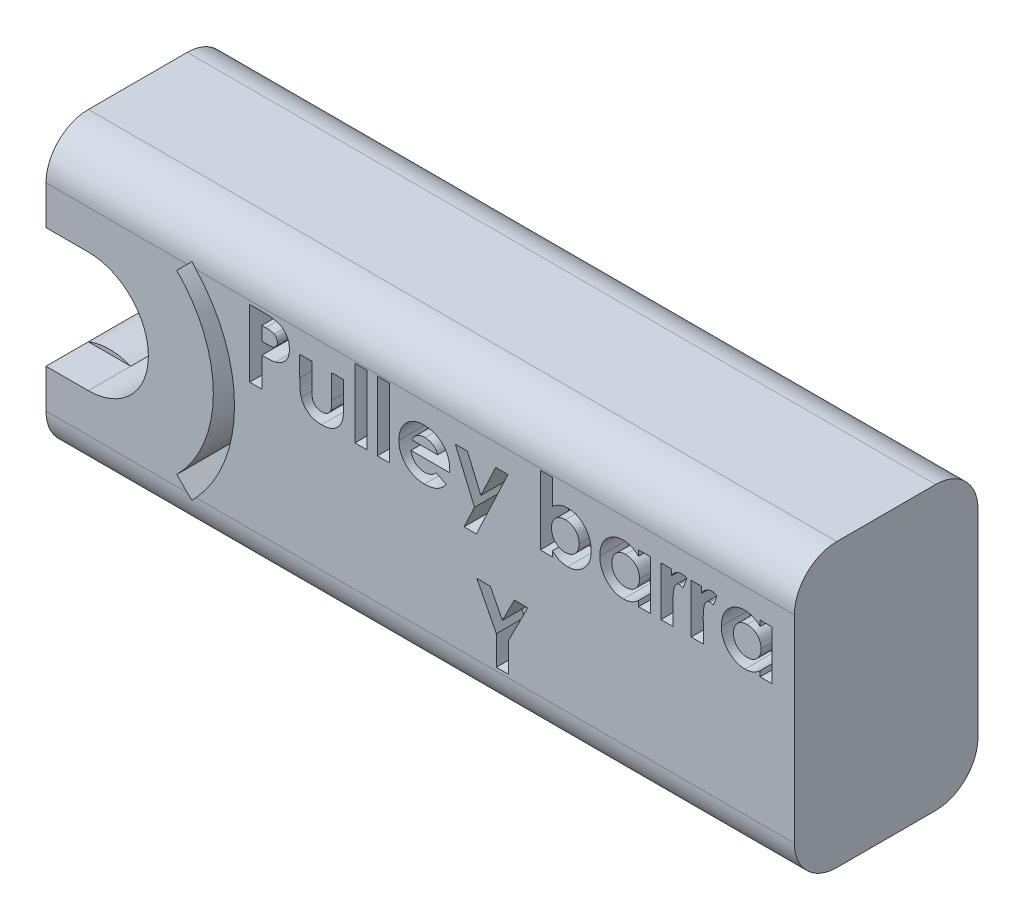
from build123d import *

# Parameters (mm, degrees)
SALIENTE_EXTRUIR1_DEPTH = 13
CORTAR_EXTRUIR1_DEPTH   = 5
CROQUIS4_W              = 0.854807692
CROQUIS4_H              = 4.884615385
CORTAR_EXTRUIR2_DEPTH   = 2
CROQUIS6_W              = 13
CROQUIS6_H              = 5.75
SALIENTE_EXTRUIR3_DEPTH = 3
REDONDEO1_R             = 3
SALIENTE_EXTRUIR4_START = -3
SALIENTE_EXTRUIR4_DEPTH = 7


with BuildPart() as part:
    # Croquis1 → Saliente-Extruir1 (new body)
    with BuildSketch(Plane.XY):
        with BuildLine():
            Line((0, 0), (0, 20))
            Line((0, 20), (-50, 20))
            Line((-50, 20), (-50, 14.25))
            ThreePointArc((-50, 14.25), (-45.75, 10), (-50, 5.75))
            Line((-50, 5.75), (-50, 0))
            Line((-50, 0), (0, 0))
        make_face()
    extrude(amount=SALIENTE_EXTRUIR1_DEPTH)

    # Croquis3 → Cortar-Extruir1 (cut)
    with BuildSketch(Plane.XY.offset(13)):
        with BuildLine():
            Line((-42.681444815, 17.318555185), (-43.742104986, 16.257895014))
            ThreePointArc((-43.742104986, 16.257895014), (-41.823666137, 13.386748376), (-41.15, 10))
            ThreePointArc((-41.15, 10), (-41.823666137, 6.613251624), (-43.742104986, 3.742104986))
            Line((-43.742104986, 3.742104986), (-42.681444815, 2.681444815))
            ThreePointArc((-42.681444815, 2.681444815), (-40.437846839, 6.039226475), (-39.65, 10))
            ThreePointArc((-39.65, 10), (-40.437846839, 13.960773525), (-42.681444815, 17.318555185))
        make_face()
    extrude(amount=-CORTAR_EXTRUIR1_DEPTH, mode=Mode.SUBTRACT)

    # Croquis4 → Cortar-Extruir2 (cut)
    # profile 1 of 12: a face of its own
    with BuildSketch(Plane.XY.offset(13)):
        with BuildLine():
            Line((-38.572356938, 16.74930767), (-37.618330495, 16.74930767))
            add(Edge.make_bspline(
                [(-37.618330495, 16.74930767), (-37.555995645, 16.749028646), (-37.435738653, 16.74849035), (-37.262318177, 16.741962797), (-37.102329296, 16.730265023), (-36.955808768, 16.715808424), (-36.822816839, 16.695540835), (-36.703186963, 16.672305632), (-36.596894313, 16.643998391), (-36.502740283, 16.610398089), (-36.418240082, 16.570784646), (-36.338275638, 16.528593501), (-36.264654156, 16.478239858), (-36.193659738, 16.425150618), (-36.129351257, 16.364254186), (-36.067716765, 16.29960331), (-36.011366651, 16.228633987), (-35.960039809, 16.152205282), (-35.913478455, 16.071729272), (-35.87279934, 15.987062089), (-35.839802721, 15.898069755), (-35.812122661, 15.805327951), (-35.789889766, 15.708840718), (-35.775090844, 15.60801465), (-35.765038671, 15.503553755), (-35.764151706, 15.432457604), (-35.763703091, 15.396498175)],
                knots=[0, 0, 0, 0, 1.698747864, 3.27724071, 4.728299578, 6.070144658, 7.288476769, 8.393259625, 9.389771311, 10.283485332, 11.113357557, 11.931608583, 12.74405601, 13.541433047, 14.344816069, 15.154114104, 15.974336324, 16.810834471, 17.661136416, 18.50621059, 19.367396281, 20.244825668, 21.142564693, 22.063065223, 23.020325768, 24, 24, 24, 24], degree=3))
            add(Edge.make_bspline(
                [(-35.763703091, 15.396498175), (-35.764352181, 15.356717116), (-35.76562772, 15.278542445), (-35.778132122, 15.16394797), (-35.79949359, 15.054692512), (-35.827411912, 14.949854702), (-35.866342026, 14.851159354), (-35.910817853, 14.756251567), (-35.965537228, 14.667792263), (-36.028062862, 14.584674923), (-36.096347987, 14.506223765), (-36.172013689, 14.434703916), (-36.253617748, 14.369627829), (-36.340687787, 14.310313502), (-36.433550693, 14.256880583), (-36.532139461, 14.208828731), (-36.637127311, 14.167694794), (-36.710237691, 14.146182077), (-36.747304353, 14.135275218)],
                knots=[0, 0, 0, 0, 1.102006807, 2.165578795, 3.188629044, 4.184801286, 5.166646146, 6.124351954, 7.085497154, 8.042432466, 9.003981491, 9.963833307, 10.922997304, 11.89326795, 12.880200226, 13.889073926, 14.929769137, 16, 16, 16, 16], degree=3))
            add(Edge.make_bspline(
                [(-36.747304353, 14.135275218), (-36.77171859, 14.129200917), (-36.824607687, 14.116042024), (-36.912124617, 14.102682445), (-37.01297869, 14.090399133), (-37.127496033, 14.079843113), (-37.255742668, 14.07266748), (-37.39759442, 14.067063629), (-37.553115571, 14.062989051), (-37.66125883, 14.062844467), (-37.717549245, 14.062769209)],
                knots=[0, 0, 0, 0, 0.618981996, 1.340914327, 2.176866532, 3.120127938, 4.170906482, 5.338178032, 6.614476169, 8, 8, 8, 8], degree=3))
            Line((-37.717549245, 14.062769209), (-37.717549245, 11.98680767))
            Line((-37.717549245, 11.98680767), (-38.572356938, 11.98680767))
            Line((-38.572356938, 11.98680767), (-38.572356938, 16.74930767))
        make_face()
        with BuildLine():
            Line((-37.717549245, 14.917576901), (-37.415122863, 14.917576901))
            add(Edge.make_bspline(
                [(-37.415122863, 14.917576901), (-37.360091608, 14.917925842), (-37.258833282, 14.918567898), (-37.120550165, 14.927852407), (-37.009423193, 14.942031727), (-36.921630821, 14.962368151), (-36.852310428, 14.993231367), (-36.792525929, 15.028934296), (-36.741247238, 15.07407967), (-36.696847439, 15.125665984), (-36.661351138, 15.184941245), (-36.636736302, 15.250940269), (-36.620746989, 15.322276347), (-36.619270227, 15.371921536), (-36.618510784, 15.397452202)],
                knots=[0, 0, 0, 0, 1.8619151, 3.425951444, 4.686033666, 5.651700536, 6.461346321, 7.243864085, 7.999046032, 8.762387399, 9.539336099, 10.322741239, 11.137448474, 12, 12, 12, 12], degree=3))
            add(Edge.make_bspline(
                [(-36.618510784, 15.397452202), (-36.619262415, 15.419758012), (-36.620720761, 15.463036647), (-36.631434165, 15.525498453), (-36.64850825, 15.583725741), (-36.673247942, 15.637110404), (-36.705230507, 15.685561735), (-36.744223725, 15.729060645), (-36.789727237, 15.7685387), (-36.824858609, 15.789435038), (-36.842706998, 15.80005136)],
                knots=[0, 0, 0, 0, 1.102301479, 2.1387299, 3.123554645, 4.094223062, 5.036071848, 5.982632524, 6.975082478, 8, 8, 8, 8], degree=3))
            add(Edge.make_bspline(
                [(-36.842706998, 15.80005136), (-36.857825613, 15.807697278), (-36.88983482, 15.823885251), (-36.944349603, 15.842704955), (-37.00725883, 15.858581448), (-37.078987209, 15.871758783), (-37.159248595, 15.881985764), (-37.248028669, 15.889806846), (-37.345458078, 15.892952008), (-37.413214402, 15.893969756), (-37.448513789, 15.894499978)],
                knots=[0, 0, 0, 0, 0.656809284, 1.390599849, 2.23162475, 3.173112763, 4.218524733, 5.370385145, 6.63003504, 8, 8, 8, 8], degree=3))
            Line((-37.448513789, 15.894499978), (-37.717549245, 15.894499978))
            Line((-37.717549245, 15.894499978), (-37.717549245, 14.917576901))
        make_face(mode=Mode.SUBTRACT)
    # profile 2 of 12: a face of its own
    with BuildSketch(Plane.XY.offset(13)):
        with BuildLine():
            Line((-35.031010784, 15.467096132), (-34.176203091, 15.467096132))
            Line((-34.176203091, 15.467096132), (-34.176203091, 13.796595831))
            add(Edge.make_bspline(
                [(-34.176203091, 13.796595831), (-34.176127184, 13.757476747), (-34.175981499, 13.68239767), (-34.171927567, 13.574569417), (-34.1662391, 13.475965417), (-34.159140277, 13.386469398), (-34.148544829, 13.306296628), (-34.13631283, 13.235600159), (-34.12244569, 13.173870614), (-34.09989597, 13.105064806), (-34.064616525, 13.029770083), (-34.011338318, 12.949835892), (-33.946802869, 12.880716189), (-33.871882097, 12.821797573), (-33.785810875, 12.77536841), (-33.68977504, 12.743904075), (-33.584982919, 12.72275677), (-33.511995363, 12.720614186), (-33.47403963, 12.719499978)],
                knots=[0, 0, 0, 0, 1.267339619, 2.432334223, 3.495366327, 4.467371443, 5.340232306, 6.114347373, 6.791623365, 7.387877112, 8.457231658, 9.474542289, 10.487879852, 11.508108106, 12.54995813, 13.638205937, 14.771795776, 16, 16, 16, 16], degree=3))
            add(Edge.make_bspline(
                [(-33.47403963, 12.719499978), (-33.436117579, 12.720771689), (-33.362941266, 12.723225647), (-33.257451921, 12.742362266), (-33.161189885, 12.775153499), (-33.073166483, 12.819630938), (-32.995977531, 12.879156413), (-32.928772267, 12.95008524), (-32.872187012, 13.033561587), (-32.844995188, 13.09583255), (-32.831025808, 13.127823295)],
                knots=[0, 0, 0, 0, 1.116871431, 2.155171802, 3.144773418, 4.104381479, 5.046960687, 6.001340237, 6.973219418, 8, 8, 8, 8], degree=3))
            add(Edge.make_bspline(
                [(-32.831025808, 13.127823295), (-32.825899515, 13.142033871), (-32.814583814, 13.173402079), (-32.804512616, 13.227516554), (-32.793673009, 13.291335815), (-32.785098494, 13.366160446), (-32.780246731, 13.45152705), (-32.775048564, 13.547543218), (-32.772399485, 13.654113324), (-32.772055949, 13.728858937), (-32.771876168, 13.767975038)],
                knots=[0, 0, 0, 0, 0.56094539, 1.238222264, 2.041156151, 2.969685991, 4.036367568, 5.220421584, 6.545382566, 8, 8, 8, 8], degree=3))
            Line((-32.771876168, 13.767975038), (-32.771876168, 15.467096132))
            Line((-32.771876168, 15.467096132), (-31.917068476, 15.467096132))
            Line((-31.917068476, 15.467096132), (-31.917068476, 14.004573596))
            add(Edge.make_bspline(
                [(-31.917068476, 14.004573596), (-31.917216485, 13.932058627), (-31.917500263, 13.793025484), (-31.925633175, 13.593586958), (-31.936857514, 13.412257531), (-31.951312303, 13.248537947), (-31.972139869, 13.102360259), (-31.997706815, 12.97406726), (-32.025992021, 12.862811172), (-32.051930609, 12.79689117), (-32.063988548, 12.766247274)],
                knots=[0, 0, 0, 0, 1.388070971, 2.661352173, 3.82033814, 4.865898334, 5.806910977, 6.645039373, 7.370126333, 8, 8, 8, 8], degree=3))
            add(Edge.make_bspline(
                [(-32.063988548, 12.766247274), (-32.079443721, 12.733264974), (-32.109950905, 12.668160747), (-32.162886539, 12.575596954), (-32.219954118, 12.487900094), (-32.283868939, 12.407134464), (-32.353326301, 12.332479212), (-32.426362865, 12.262237242), (-32.506267817, 12.199268913), (-32.590968926, 12.141953873), (-32.68164808, 12.091075794), (-32.777684191, 12.045989199), (-32.880115083, 12.009296442), (-32.988052559, 11.978194155), (-33.10199414, 11.95499958), (-33.221710304, 11.937431459), (-33.34733235, 11.928352187), (-33.433004259, 11.926631593), (-33.476901709, 11.925749978)],
                knots=[0, 0, 0, 0, 0.997311338, 1.968606903, 2.91805772, 3.860812155, 4.785445165, 5.709667791, 6.633356648, 7.568312411, 8.508286151, 9.478643871, 10.470653671, 11.485274776, 12.552984541, 13.653035246, 14.797438149, 16, 16, 16, 16], degree=3))
            add(Edge.make_bspline(
                [(-33.476901709, 11.925749978), (-33.524323291, 11.926315118), (-33.617111246, 11.927420906), (-33.752673152, 11.94096247), (-33.881865472, 11.958483494), (-34.003245779, 11.988272446), (-34.118509208, 12.022784438), (-34.226332469, 12.066830918), (-34.327156155, 12.1186171), (-34.421178649, 12.177835964), (-34.507670749, 12.24503019), (-34.588555701, 12.317295241), (-34.661222193, 12.397506314), (-34.72804249, 12.483186459), (-34.788270839, 12.575124233), (-34.841937135, 12.672992734), (-34.889086835, 12.777237116), (-34.914243538, 12.850297543), (-34.927021902, 12.887408632)],
                knots=[0, 0, 0, 0, 1.211240017, 2.369985978, 3.478996442, 4.539426614, 5.559871561, 6.551301256, 7.510778031, 8.453136967, 9.386094087, 10.30661716, 11.221130616, 12.147659962, 13.080758632, 14.026335491, 14.997475882, 16, 16, 16, 16], degree=3))
            add(Edge.make_bspline(
                [(-34.927021902, 12.887408632), (-34.935739718, 12.916230524), (-34.954519926, 12.9783196), (-34.974796796, 13.081504396), (-34.991014975, 13.200430652), (-35.006791506, 13.335215347), (-35.017797503, 13.486084448), (-35.024991153, 13.652798356), (-35.02985168, 13.835683078), (-35.030613033, 13.962911075), (-35.031010784, 14.029378283)],
                knots=[0, 0, 0, 0, 0.627914866, 1.352675004, 2.190563461, 3.132055958, 4.183353232, 5.345633452, 6.613289997, 8, 8, 8, 8], degree=3))
            Line((-35.031010784, 14.029378283), (-35.031010784, 15.467096132))
        make_face()
    # profile 3 of 12: a face of its own
    with BuildSketch(Plane.XY.offset(13)):
        with Locations((-30.69591463, 14.429115363)):
            Rectangle(CROQUIS4_W, CROQUIS4_H)
    # profile 4 of 12: a face of its own
    with BuildSketch(Plane.XY.offset(13)):
        with Locations((-29.10841463, 14.429115363)):
            Rectangle(CROQUIS4_W, CROQUIS4_H)
    # profile 5 of 12: a face of its own
    with BuildSketch(Plane.XY.offset(13)):
        with BuildLine():
            Line((-24.409834402, 13.513249978), (-27.154568476, 13.513249978))
            add(Edge.make_bspline(
                [(-27.154568476, 13.513249978), (-27.148972185, 13.481357725), (-27.137975031, 13.418686932), (-27.114094321, 13.327652168), (-27.083618954, 13.241862542), (-27.047096145, 13.161203375), (-27.005141669, 13.085248255), (-26.956205249, 13.014353439), (-26.900907598, 12.948581548), (-26.839568433, 12.888218432), (-26.773210166, 12.834131773), (-26.702154611, 12.78674844), (-26.626328442, 12.747897005), (-26.546600978, 12.715149277), (-26.462376472, 12.689209759), (-26.373530965, 12.671319767), (-26.280299975, 12.660752083), (-26.216788176, 12.659223589), (-26.184323584, 12.658442286)],
                knots=[0, 0, 0, 0, 1.091296461, 2.144483647, 3.168565212, 4.157007626, 5.126487748, 6.090021542, 7.05641414, 8.019231907, 8.98705074, 9.938580405, 10.892824166, 11.854447369, 12.841318655, 13.858982407, 14.905600794, 16, 16, 16, 16], degree=3))
            add(Edge.make_bspline(
                [(-26.184323584, 12.658442286), (-26.145136618, 12.65947686), (-26.067965941, 12.66151424), (-25.954910325, 12.679582778), (-25.845569076, 12.706874511), (-25.740976947, 12.747459609), (-25.639922403, 12.797980921), (-25.544069112, 12.860924259), (-25.451757928, 12.934450214), (-25.395437228, 12.991123992), (-25.366722923, 13.020018307)],
                knots=[0, 0, 0, 0, 1.021034703, 2.010718019, 2.977989445, 3.954245119, 4.929443971, 5.918328161, 6.938689359, 8, 8, 8, 8], degree=3))
            Line((-25.366722923, 13.020018307), (-24.651203091, 12.679430868))
            add(Edge.make_bspline(
                [(-24.651203091, 12.679430868), (-24.673730816, 12.64830101), (-24.718368673, 12.586618342), (-24.791238477, 12.499814898), (-24.867282757, 12.418823763), (-24.946558228, 12.344177628), (-25.02916543, 12.276089206), (-25.11487457, 12.213729056), (-25.204938253, 12.158771523), (-25.29755567, 12.108557795), (-25.394641396, 12.065509799), (-25.495926751, 12.028799988), (-25.600982736, 11.995614631), (-25.711135979, 11.970329207), (-25.825469237, 11.950313471), (-25.944256016, 11.936099648), (-26.067480662, 11.92732045), (-26.151235735, 11.926279687), (-26.193863849, 11.925749978)],
                knots=[0, 0, 0, 0, 1.028154879, 2.037251081, 3.030720504, 4.000128189, 4.949298328, 5.894184978, 6.834267904, 7.770992897, 8.712077017, 9.673380525, 10.653304757, 11.658697181, 12.695551717, 13.758623199, 14.859225354, 16, 16, 16, 16], degree=3))
            add(Edge.make_bspline(
                [(-26.193863849, 11.925749978), (-26.259446501, 11.927087011), (-26.387886346, 11.929705513), (-26.575752838, 11.954008959), (-26.754173898, 11.994306693), (-26.923653326, 12.049085273), (-27.083458519, 12.121410159), (-27.233668564, 12.209869494), (-27.375784275, 12.312767336), (-27.505463223, 12.432263236), (-27.62360457, 12.56232742), (-27.727372585, 12.702007471), (-27.814204181, 12.850327499), (-27.885512035, 13.00630589), (-27.940934976, 13.170341887), (-27.980891701, 13.342507074), (-28.005385653, 13.52271922), (-28.008031121, 13.645463808), (-28.009376168, 13.707871372)],
                knots=[0, 0, 0, 0, 1.103565453, 2.161269334, 3.182010356, 4.179077853, 5.15417608, 6.128274628, 7.109042802, 8.101804412, 9.090965879, 10.063106201, 11.02526161, 11.978650795, 12.945248442, 13.93468508, 14.949922959, 16, 16, 16, 16], degree=3))
            add(Edge.make_bspline(
                [(-28.009376168, 13.707871372), (-28.008017883, 13.771864793), (-28.005345518, 13.897768974), (-27.981102594, 14.082142301), (-27.940824509, 14.258059392), (-27.885239444, 14.425762505), (-27.815013339, 14.585776141), (-27.72707696, 14.736700375), (-27.623656065, 14.879060641), (-27.505940319, 15.012190964), (-27.375712011, 15.132355626), (-27.23733213, 15.239446354), (-27.089245836, 15.328681456), (-26.933128113, 15.400783364), (-26.769977546, 15.459364343), (-26.597908342, 15.498345093), (-26.418229687, 15.524518333), (-26.295405315, 15.526928725), (-26.232978933, 15.528153824)],
                knots=[0, 0, 0, 0, 1.079208495, 2.12329425, 3.130605359, 4.119693003, 5.099659317, 6.073216462, 7.060498243, 8.06384408, 9.066070512, 10.045757761, 11.010926815, 11.975797609, 12.942977511, 13.929384301, 14.947594487, 16, 16, 16, 16], degree=3))
            add(Edge.make_bspline(
                [(-26.232978933, 15.528153824), (-26.167082095, 15.526796048), (-26.037700445, 15.524130195), (-25.848525521, 15.500024087), (-25.668919766, 15.459480623), (-25.49811796, 15.405175703), (-25.33830131, 15.331023815), (-25.185958162, 15.244741323), (-25.044742566, 15.139619266), (-24.913149317, 15.020708141), (-24.794359515, 14.888780367), (-24.690524066, 14.745466399), (-24.602172879, 14.592164895), (-24.530563365, 14.428254187), (-24.475197333, 14.254226349), (-24.43520362, 14.070307392), (-24.410896499, 13.875797775), (-24.408300257, 13.742605892), (-24.406972322, 13.674480447)],
                knots=[0, 0, 0, 0, 1.080001299, 2.120471247, 3.119684163, 4.095710327, 5.052285597, 6.002875087, 6.961153713, 7.931888285, 8.906493152, 9.865905668, 10.82813294, 11.801621613, 12.7925306, 13.817193356, 14.883530496, 16, 16, 16, 16], degree=3))
            Line((-24.406972322, 13.674480447), (-24.409834402, 13.513249978))
        make_face()
        with BuildLine():
            add(Edge.make_bspline(
                [(-25.261780014, 14.184884593), (-25.277910758, 14.228414937), (-25.30998288, 14.3149646), (-25.382432466, 14.434382017), (-25.47857075, 14.537802349), (-25.59038647, 14.62936119), (-25.718142933, 14.703676064), (-25.857814307, 14.757482447), (-26.007635173, 14.789745429), (-26.110703856, 14.79352931), (-26.163335002, 14.795461517)],
                knots=[0, 0, 0, 0, 0.954238005, 1.897273737, 2.851915805, 3.847685534, 4.862635127, 5.880135777, 6.917509367, 8, 8, 8, 8], degree=3))
            add(Edge.make_bspline(
                [(-26.163335002, 14.795461517), (-26.220816783, 14.793605397), (-26.333181696, 14.789977069), (-26.495260432, 14.751388473), (-26.648145247, 14.693796147), (-26.73827747, 14.634417235), (-26.78345219, 14.604656228)],
                knots=[0, 0, 0, 0, 1.044195649, 2.041185066, 3.018232172, 4, 4, 4, 4], degree=3))
            add(Edge.make_bspline(
                [(-26.78345219, 14.604656228), (-26.811637841, 14.581989593), (-26.871728209, 14.533665486), (-26.949767743, 14.437263481), (-27.026637333, 14.320542294), (-27.070341934, 14.231884306), (-27.093510784, 14.184884593)],
                knots=[0, 0, 0, 0, 0.82159062, 1.751589201, 2.808063854, 4, 4, 4, 4], degree=3))
            Line((-27.093510784, 14.184884593), (-25.261780014, 14.184884593))
        make_face(mode=Mode.SUBTRACT)
    # profile 6 of 12: a face of its own
    with BuildSketch(Plane.XY.offset(13)):
        Polygon((-24.012005375, 15.467096132), (-23.156243656, 15.467096132), (-22.20603332, 13.227996072), (-21.15469618, 15.467096132), (-20.285578091, 15.467096132), (-22.522770099, 10.704596132), (-23.391888188, 10.704596132), (-22.656333801, 12.270153524), align=None)
    # profile 7 of 12: a face of its own
    with BuildSketch(Plane.XY.offset(13)):
        with BuildLine():
            Line((-17.141106938, 16.871423055), (-17.141106938, 15.061634894))
            add(Edge.make_bspline(
                [(-17.141106938, 15.061634894), (-17.101413578, 15.099008585), (-17.023493399, 15.172375129), (-16.896271617, 15.267246102), (-16.764485005, 15.347316425), (-16.628251622, 15.41449168), (-16.486345357, 15.464164885), (-16.340509784, 15.502762826), (-16.189250568, 15.523205109), (-16.086960353, 15.526495141), (-16.035390291, 15.528153824)],
                knots=[0, 0, 0, 0, 1.061187343, 2.083167259, 3.083809127, 4.061667593, 5.035358583, 6.007314429, 6.995378812, 8, 8, 8, 8], degree=3))
            add(Edge.make_bspline(
                [(-16.035390291, 15.528153824), (-15.979332935, 15.526811109), (-15.868918132, 15.524166396), (-15.70646376, 15.499474202), (-15.550780577, 15.45956097), (-15.401274923, 15.403831219), (-15.258743347, 15.331475445), (-15.121584407, 15.244843067), (-14.992163568, 15.140359158), (-14.870417915, 15.022013612), (-14.757800154, 14.892298102), (-14.659843441, 14.751269812), (-14.578249301, 14.600784946), (-14.509094258, 14.442622548), (-14.45862213, 14.274159549), (-14.419722426, 14.097655765), (-14.398045327, 13.911617937), (-14.395041891, 13.784881861), (-14.393510784, 13.720273716)],
                knots=[0, 0, 0, 0, 0.985987466, 1.942075377, 2.884088208, 3.810275091, 4.743821533, 5.692411115, 6.659945104, 7.665215984, 8.677116751, 9.678438675, 10.680260931, 11.685531812, 12.710472044, 13.769734641, 14.863044265, 16, 16, 16, 16], degree=3))
            add(Edge.make_bspline(
                [(-14.393510784, 13.720273716), (-14.394959874, 13.65787728), (-14.397816351, 13.534880146), (-14.420894884, 13.354310233), (-14.460011065, 13.181814777), (-14.514883139, 13.017331657), (-14.584640329, 12.860341076), (-14.669783794, 12.710951211), (-14.770810195, 12.569683876), (-14.886309441, 12.438442086), (-15.012509151, 12.319592888), (-15.144000204, 12.212961528), (-15.283401469, 12.125585491), (-15.427228224, 12.051789733), (-15.577746288, 11.995359545), (-15.733927555, 11.955823856), (-15.895524672, 11.929391795), (-16.00539103, 11.926976008), (-16.061149005, 11.925749978)],
                knots=[0, 0, 0, 0, 1.098553145, 2.165490463, 3.199345634, 4.208780719, 5.21409072, 6.219899742, 7.23156933, 8.267303578, 9.293302409, 10.281606823, 11.243293419, 12.184993323, 13.124258899, 14.066907486, 15.018941492, 16, 16, 16, 16], degree=3))
            add(Edge.make_bspline(
                [(-16.061149005, 11.925749978), (-16.110816822, 11.92707773), (-16.208616365, 11.92969217), (-16.352776961, 11.949082869), (-16.49131006, 11.981694287), (-16.625965664, 12.026616727), (-16.757109138, 12.087993988), (-16.887024348, 12.164738223), (-17.0165474, 12.257820424), (-17.09875131, 12.329550973), (-17.141106938, 12.366510194)],
                knots=[0, 0, 0, 0, 0.996418773, 1.962021009, 2.912343664, 3.848616743, 4.805003894, 5.811808768, 6.872532775, 8, 8, 8, 8], degree=3))
            Line((-17.141106938, 12.366510194), (-17.141106938, 11.98680767))
            Line((-17.141106938, 11.98680767), (-17.99591463, 11.98680767))
            Line((-17.99591463, 11.98680767), (-17.99591463, 16.871423055))
            Line((-17.99591463, 16.871423055), (-17.141106938, 16.871423055))
        make_face()
        with BuildLine():
            add(Edge.make_bspline(
                [(-16.220471421, 14.734403824), (-16.255162067, 14.733337063), (-16.323174592, 14.731245631), (-16.423029367, 14.719259644), (-16.517643524, 14.696707922), (-16.608455595, 14.667478581), (-16.694315638, 14.628023561), (-16.775926085, 14.580195967), (-16.852587936, 14.523165211), (-16.924699063, 14.459189643), (-16.989496643, 14.387217007), (-17.047063673, 14.310310514), (-17.094823192, 14.227468694), (-17.134635957, 14.139741973), (-17.164672948, 14.046181157), (-17.186951694, 13.947582168), (-17.19905878, 13.843642846), (-17.201112972, 13.77277396), (-17.20216463, 13.736492166)],
                knots=[0, 0, 0, 0, 1.060469436, 2.079096586, 3.066888298, 4.028858836, 4.99004353, 5.948472697, 6.914558426, 7.905691313, 8.889602648, 9.869280844, 10.836099585, 11.806137001, 12.808075328, 13.83377171, 14.890985086, 16, 16, 16, 16], degree=3))
            add(Edge.make_bspline(
                [(-17.20216463, 13.736492166), (-17.201099739, 13.69957541), (-17.199009846, 13.627124687), (-17.187003688, 13.520968997), (-17.164881317, 13.420394615), (-17.13421169, 13.325173513), (-17.095076393, 13.235293337), (-17.047373459, 13.150420887), (-16.989172766, 13.072416949), (-16.925087011, 12.998546706), (-16.852530003, 12.933715131), (-16.776213515, 12.875570126), (-16.694335465, 12.827671239), (-16.608065094, 12.788861818), (-16.518057014, 12.756611402), (-16.422969934, 12.73481983), (-16.323190363, 12.722611557), (-16.255167394, 12.720550994), (-16.220471421, 12.719499978)],
                knots=[0, 0, 0, 0, 1.117193555, 2.192540452, 3.22680955, 4.227918444, 5.21468246, 6.188555072, 7.166222992, 8.154674427, 9.142376254, 10.104580718, 11.053462639, 12.005072638, 12.963662044, 13.941614018, 14.950094269, 16, 16, 16, 16], degree=3))
            add(Edge.make_bspline(
                [(-16.220471421, 12.719499978), (-16.187037503, 12.72047634), (-16.120857524, 12.722408976), (-16.024025003, 12.735894235), (-15.930944827, 12.757930487), (-15.842345934, 12.789340118), (-15.75768899, 12.830235426), (-15.676203303, 12.878089705), (-15.600702063, 12.937880054), (-15.528223233, 13.003594752), (-15.463374043, 13.077702031), (-15.405196526, 13.156431254), (-15.356325683, 13.240485097), (-15.317523385, 13.330142292), (-15.285444419, 13.423704605), (-15.263543097, 13.522884546), (-15.251493391, 13.626796867), (-15.249387295, 13.697665219), (-15.248318476, 13.733630086)],
                knots=[0, 0, 0, 0, 1.021711385, 2.02240246, 2.981887075, 3.941027022, 4.888772411, 5.852236371, 6.822344989, 7.82661704, 8.838806642, 9.826383926, 10.814965113, 11.80282933, 12.807900643, 13.833672313, 14.900613836, 16, 16, 16, 16], degree=3))
            add(Edge.make_bspline(
                [(-15.248318476, 13.733630086), (-15.249404364, 13.76927139), (-15.251543867, 13.839494738), (-15.263346821, 13.942541747), (-15.286091377, 14.040279783), (-15.314809274, 14.133507296), (-15.354930751, 14.221010704), (-15.402370351, 14.303825161), (-15.458191831, 14.382200719), (-15.522947152, 14.45402162), (-15.593972327, 14.51937348), (-15.669790491, 14.57717774), (-15.750103899, 14.626385635), (-15.836006245, 14.665191633), (-15.925470369, 14.697120607), (-16.019863469, 14.719113706), (-16.118705659, 14.731285917), (-16.186093899, 14.733350563), (-16.220471421, 14.734403824)],
                knots=[0, 0, 0, 0, 1.094680664, 2.156827393, 3.177782763, 4.17210342, 5.146667393, 6.126451192, 7.099203661, 8.094961544, 9.09004898, 10.058676268, 11.018205477, 11.974998356, 12.947750825, 13.930643515, 14.944335875, 16, 16, 16, 16], degree=3))
        make_face(mode=Mode.SUBTRACT)
    # profile 8 of 12: a face of its own
    with BuildSketch(Plane.XY.offset(13)):
        with BuildLine():
            Line((-11.035337707, 15.467096132), (-10.180530014, 15.467096132))
            Line((-10.180530014, 15.467096132), (-10.180530014, 11.98680767))
            Line((-10.180530014, 11.98680767), (-11.035337707, 11.98680767))
            Line((-11.035337707, 11.98680767), (-11.035337707, 12.366510194))
            add(Edge.make_bspline(
                [(-11.035337707, 12.366510194), (-11.077693113, 12.329550356), (-11.159896592, 12.257818609), (-11.289422676, 12.164744843), (-11.419327249, 12.087971015), (-11.550234508, 12.026824848), (-11.684156442, 11.981674697), (-11.822057235, 11.948984933), (-11.965922805, 11.92970698), (-12.063720638, 11.927082718), (-12.113387587, 11.925749978)],
                knots=[0, 0, 0, 0, 1.129196829, 2.191548051, 3.199897424, 4.157751732, 5.089409408, 6.034969131, 7.002052659, 8, 8, 8, 8], degree=3))
            add(Edge.make_bspline(
                [(-12.113387587, 11.925749978), (-12.169140944, 11.927004254), (-12.279312739, 11.929482775), (-12.440977616, 11.955573205), (-12.597081127, 11.995510424), (-12.74749656, 12.05202658), (-12.891950246, 12.125260439), (-13.031547696, 12.213301227), (-13.163895782, 12.319239702), (-13.290096259, 12.438492176), (-13.405644658, 12.569670746), (-13.506658159, 12.710954672), (-13.591805034, 12.860340152), (-13.661561312, 13.017331906), (-13.716433633, 13.181814709), (-13.755549745, 13.354310252), (-13.778628297, 13.534880141), (-13.781484771, 13.657877278), (-13.782933861, 13.720273716)],
                knots=[0, 0, 0, 0, 0.980476535, 1.937477201, 2.874147792, 3.812856188, 4.758993464, 5.720109578, 6.712210464, 7.737600662, 8.772720504, 9.783789959, 10.789002326, 11.793715968, 12.802552247, 13.835794126, 14.902098527, 16, 16, 16, 16], degree=3))
            add(Edge.make_bspline(
                [(-13.782933861, 13.720273716), (-13.781413036, 13.78488531), (-13.778429769, 13.91162815), (-13.75660735, 14.097617242), (-13.718213077, 14.274389797), (-13.665859725, 14.442190672), (-13.598516229, 14.601048857), (-13.516496351, 14.751224611), (-13.418684286, 14.892325399), (-13.305973221, 15.021949587), (-13.184272954, 15.140756416), (-13.054075183, 15.244187183), (-12.917415916, 15.332056432), (-12.77414993, 15.403791838), (-12.624297682, 15.45922533), (-12.468450788, 15.499751738), (-12.305917398, 15.524069007), (-12.195198334, 15.526780911), (-12.139146301, 15.528153824)],
                knots=[0, 0, 0, 0, 1.136281865, 2.228943489, 3.287578264, 4.313574083, 5.316051562, 6.317280042, 7.318008486, 8.329309503, 9.333984563, 10.305318864, 11.248632312, 12.186624717, 13.117503092, 14.05354244, 15.014596925, 16, 16, 16, 16], degree=3))
            add(Edge.make_bspline(
                [(-12.139146301, 15.528153824), (-12.087223955, 15.527075127), (-11.984488349, 15.524940773), (-11.83348181, 15.501765776), (-11.687027247, 15.466715239), (-11.545923577, 15.416774533), (-11.409013421, 15.353714232), (-11.278651719, 15.274694974), (-11.151986691, 15.183037904), (-11.074701109, 15.11145179), (-11.035337707, 15.074991264)],
                knots=[0, 0, 0, 0, 1.017011718, 2.012299608, 2.98747302, 3.965332399, 4.941441765, 5.936729654, 6.94912688, 8, 8, 8, 8], degree=3))
            Line((-11.035337707, 15.074991264), (-11.035337707, 15.467096132))
        make_face()
        with BuildLine():
            add(Edge.make_bspline(
                [(-11.959789329, 14.734403824), (-11.993850896, 14.733358698), (-12.060609343, 14.731310318), (-12.158786775, 14.718989172), (-12.252614948, 14.697278764), (-12.341424687, 14.665206297), (-12.426539582, 14.62613736), (-12.506667153, 14.57720416), (-12.582468714, 14.519366157), (-12.65349847, 14.454023608), (-12.718252558, 14.3822002), (-12.774074361, 14.3038253), (-12.821513875, 14.221010667), (-12.861635375, 14.133507306), (-12.890353266, 14.04027978), (-12.913097824, 13.942541748), (-12.924900777, 13.839494738), (-12.92704028, 13.76927139), (-12.928126168, 13.733630086)],
                knots=[0, 0, 0, 0, 1.04836806, 2.054732945, 3.03993516, 4.00574415, 4.955904794, 5.917688631, 6.888591924, 7.88601754, 8.884115178, 9.859153345, 10.841239365, 11.818093293, 12.814750328, 13.83810466, 14.90274714, 16, 16, 16, 16], degree=3))
            add(Edge.make_bspline(
                [(-12.928126168, 13.733630086), (-12.927056868, 13.697665495), (-12.924949823, 13.626797685), (-12.912906982, 13.522881437), (-12.890980867, 13.423715681), (-12.858991492, 13.330102105), (-12.819925046, 13.240777553), (-12.772372395, 13.156154265), (-12.713962292, 13.077728487), (-12.64915144, 13.003644402), (-12.57666452, 12.937490189), (-12.500434042, 12.878751321), (-12.41941876, 12.829604549), (-12.33449763, 12.789883816), (-12.245956502, 12.757514758), (-12.152685339, 12.736077205), (-12.055597848, 12.722372583), (-11.989410742, 12.720464125), (-11.955973224, 12.719499978)],
                knots=[0, 0, 0, 0, 1.099136573, 2.165835871, 3.191374663, 4.196217796, 5.183857741, 6.167377911, 7.154730987, 8.166690795, 9.170734848, 10.148332609, 11.103258353, 12.059567475, 13.009337315, 13.978056681, 14.978520572, 16, 16, 16, 16], degree=3))
            add(Edge.make_bspline(
                [(-11.955973224, 12.719499978), (-11.92127722, 12.720550964), (-11.853254193, 12.722611467), (-11.753475046, 12.734820169), (-11.658386424, 12.756610181), (-11.568383947, 12.788866269), (-11.482092913, 12.827654769), (-11.400292021, 12.875631777), (-11.323868933, 12.933337058), (-11.252436603, 12.999270305), (-11.186982642, 13.071680194), (-11.130388867, 13.151082856), (-11.081093619, 13.234938776), (-11.042325174, 13.325230613), (-11.011537593, 13.420378681), (-10.989448213, 13.52097349), (-10.977432871, 13.627123493), (-10.975344254, 13.699575007), (-10.974280014, 13.736492166)],
                knots=[0, 0, 0, 0, 1.050008698, 2.058587853, 3.036635738, 3.995319155, 4.947022481, 5.895997462, 6.858296291, 7.838991643, 8.833936038, 9.806048392, 10.784806122, 11.771666913, 12.772873988, 13.80724452, 14.882696879, 16, 16, 16, 16], degree=3))
            add(Edge.make_bspline(
                [(-10.974280014, 13.736492166), (-10.97533103, 13.772774367), (-10.977383969, 13.843644045), (-10.989500032, 13.947577686), (-11.011746234, 14.046197273), (-11.041900156, 14.13968408), (-11.081358303, 14.227824351), (-11.13069085, 14.309640822), (-11.186663823, 14.387968125), (-11.252842454, 14.458421822), (-11.323887819, 14.523877662), (-11.401434832, 14.579837893), (-11.483040341, 14.628065973), (-11.56920573, 14.667663087), (-11.660728854, 14.696689272), (-11.755979976, 14.719163186), (-11.856445211, 14.731302923), (-11.924779137, 14.733353323), (-11.959789329, 14.734403824)],
                knots=[0, 0, 0, 0, 1.106611376, 2.161533483, 3.185006901, 4.184773755, 5.152708835, 6.122342771, 7.094156588, 8.082475533, 9.064254463, 10.03606828, 10.992420271, 11.951521816, 12.920622147, 13.915721683, 14.932141191, 16, 16, 16, 16], degree=3))
        make_face(mode=Mode.SUBTRACT)
    # profile 9 of 12: a face of its own
    with BuildSketch(Plane.XY.offset(13)):
        with BuildLine():
            Line((-9.447837707, 15.467096132), (-8.715145399, 15.467096132))
            Line((-8.715145399, 15.467096132), (-8.715145399, 15.038738259))
            add(Edge.make_bspline(
                [(-8.715145399, 15.038738259), (-8.69441894, 15.076806541), (-8.653908217, 15.151212578), (-8.57948662, 15.251087947), (-8.493988075, 15.335200196), (-8.40048481, 15.40530861), (-8.298693433, 15.459951235), (-8.191339738, 15.498890993), (-8.079342132, 15.52419644), (-8.002941162, 15.526825198), (-7.964326589, 15.528153824)],
                knots=[0, 0, 0, 0, 1.09866127, 2.147379032, 3.14564304, 4.131443017, 5.102343063, 6.064490016, 7.021754664, 8, 8, 8, 8], degree=3))
            add(Edge.make_bspline(
                [(-7.964326589, 15.528153824), (-7.93628759, 15.526840864), (-7.879190177, 15.524167207), (-7.792165685, 15.508625202), (-7.703885581, 15.480522301), (-7.645789666, 15.455219374), (-7.616106938, 15.442291444)],
                knots=[0, 0, 0, 0, 0.931404136, 1.896671404, 2.925354185, 4, 4, 4, 4], degree=3))
            Line((-7.616106938, 15.442291444), (-7.881326289, 14.718185375))
            add(Edge.make_bspline(
                [(-7.881326289, 14.718185375), (-7.905033111, 14.729639365), (-7.949592812, 14.751168458), (-8.01428576, 14.776575006), (-8.072997293, 14.792076839), (-8.110219327, 14.794389849), (-8.127465111, 14.795461517)],
                knots=[0, 0, 0, 0, 1.214386998, 2.282580073, 3.20428172, 4, 4, 4, 4], degree=3))
            add(Edge.make_bspline(
                [(-8.127465111, 14.795461517), (-8.143748484, 14.794751373), (-8.175780686, 14.793354398), (-8.22305932, 14.781382795), (-8.267585948, 14.760738136), (-8.311506305, 14.73429028), (-8.351355563, 14.697525782), (-8.391180207, 14.654964347), (-8.426275816, 14.602416595), (-8.463311861, 14.543928278), (-8.494846729, 14.472338631), (-8.521886908, 14.386875346), (-8.545979924, 14.286549553), (-8.562559208, 14.170828571), (-8.578583752, 14.040832201), (-8.588121955, 13.895606286), (-8.595230897, 13.735610044), (-8.595665562, 13.623926893), (-8.595892094, 13.565721432)],
                knots=[0, 0, 0, 0, 0.544232178, 1.070598461, 1.618251235, 2.182094276, 2.777567932, 3.425210017, 4.127676488, 4.886675562, 5.738955394, 6.734782583, 7.883056018, 9.186093582, 10.642914445, 12.264202625, 14.053029461, 16, 16, 16, 16], degree=3))
            Line((-8.595892094, 13.565721432), (-8.593030014, 13.395904726))
            Line((-8.593030014, 13.395904726), (-8.593030014, 11.98680767))
            Line((-8.593030014, 11.98680767), (-9.447837707, 11.98680767))
            Line((-9.447837707, 11.98680767), (-9.447837707, 15.467096132))
        make_face()
    # profile 10 of 12: a face of its own
    with BuildSketch(Plane.XY.offset(13)):
        with BuildLine():
            Line((-7.310818476, 15.467096132), (-6.578126168, 15.467096132))
            Line((-6.578126168, 15.467096132), (-6.578126168, 15.038738259))
            add(Edge.make_bspline(
                [(-6.578126168, 15.038738259), (-6.55739971, 15.076806541), (-6.516888986, 15.151212578), (-6.442467389, 15.251087947), (-6.356968844, 15.335200196), (-6.263465579, 15.40530861), (-6.161674203, 15.459951235), (-6.054320507, 15.498890993), (-5.942322901, 15.52419644), (-5.865921932, 15.526825198), (-5.827307358, 15.528153824)],
                knots=[0, 0, 0, 0, 1.09866127, 2.147379032, 3.14564304, 4.131443017, 5.102343063, 6.064490016, 7.021754664, 8, 8, 8, 8], degree=3))
            add(Edge.make_bspline(
                [(-5.827307358, 15.528153824), (-5.79926836, 15.526840864), (-5.742170946, 15.524167207), (-5.655146454, 15.508625202), (-5.566866351, 15.480522301), (-5.508770436, 15.455219374), (-5.479087707, 15.442291444)],
                knots=[0, 0, 0, 0, 0.931404136, 1.896671404, 2.925354185, 4, 4, 4, 4], degree=3))
            Line((-5.479087707, 15.442291444), (-5.744307058, 14.718185375))
            add(Edge.make_bspline(
                [(-5.744307058, 14.718185375), (-5.76801388, 14.729639365), (-5.812573581, 14.751168458), (-5.877266529, 14.776575006), (-5.935978062, 14.792076839), (-5.973200096, 14.794389849), (-5.99044588, 14.795461517)],
                knots=[0, 0, 0, 0, 1.214386998, 2.282580073, 3.20428172, 4, 4, 4, 4], degree=3))
            add(Edge.make_bspline(
                [(-5.99044588, 14.795461517), (-6.006729254, 14.794751373), (-6.038761455, 14.793354398), (-6.086040089, 14.781382795), (-6.130566717, 14.760738136), (-6.174487074, 14.73429028), (-6.214336332, 14.697525782), (-6.254160976, 14.654964347), (-6.289256585, 14.602416595), (-6.32629263, 14.543928278), (-6.357827498, 14.472338631), (-6.384867677, 14.386875346), (-6.408960693, 14.286549553), (-6.425539978, 14.170828571), (-6.441564522, 14.040832201), (-6.451102724, 13.895606286), (-6.458211667, 13.735610044), (-6.458646331, 13.623926893), (-6.458872863, 13.565721432)],
                knots=[0, 0, 0, 0, 0.544232178, 1.070598461, 1.618251235, 2.182094276, 2.777567932, 3.425210017, 4.127676488, 4.886675562, 5.738955394, 6.734782583, 7.883056018, 9.186093582, 10.642914445, 12.264202625, 14.053029461, 16, 16, 16, 16], degree=3))
            Line((-6.458872863, 13.565721432), (-6.456010784, 13.395904726))
            Line((-6.456010784, 13.395904726), (-6.456010784, 11.98680767))
            Line((-6.456010784, 11.98680767), (-7.310818476, 11.98680767))
            Line((-7.310818476, 11.98680767), (-7.310818476, 15.467096132))
        make_face()
    # profile 11 of 12: a face of its own
    with BuildSketch(Plane.XY.offset(13)):
        with BuildLine():
            Line((-2.426203091, 15.467096132), (-1.571395399, 15.467096132))
            Line((-1.571395399, 15.467096132), (-1.571395399, 11.98680767))
            Line((-1.571395399, 11.98680767), (-2.426203091, 11.98680767))
            Line((-2.426203091, 11.98680767), (-2.426203091, 12.366510194))
            add(Edge.make_bspline(
                [(-2.426203091, 12.366510194), (-2.468558498, 12.329550356), (-2.550761977, 12.257818609), (-2.68028806, 12.164744843), (-2.810192634, 12.087971015), (-2.941099893, 12.026824848), (-3.075021827, 11.981674697), (-3.21292262, 11.948984933), (-3.35678819, 11.92970698), (-3.454586023, 11.927082718), (-3.504252971, 11.925749978)],
                knots=[0, 0, 0, 0, 1.129196829, 2.191548051, 3.199897424, 4.157751732, 5.089409408, 6.034969131, 7.002052659, 8, 8, 8, 8], degree=3))
            add(Edge.make_bspline(
                [(-3.504252971, 11.925749978), (-3.560006329, 11.927004254), (-3.670178123, 11.929482775), (-3.831843, 11.955573205), (-3.987946512, 11.995510424), (-4.138361944, 12.05202658), (-4.282815631, 12.125260439), (-4.42241308, 12.213301227), (-4.554761167, 12.319239702), (-4.680961643, 12.438492176), (-4.796510043, 12.569670746), (-4.897523544, 12.710954672), (-4.982670418, 12.860340152), (-5.052426696, 13.017331906), (-5.107299017, 13.181814709), (-5.14641513, 13.354310252), (-5.169493682, 13.534880141), (-5.172350156, 13.657877278), (-5.173799245, 13.720273716)],
                knots=[0, 0, 0, 0, 0.980476535, 1.937477201, 2.874147792, 3.812856188, 4.758993464, 5.720109578, 6.712210464, 7.737600662, 8.772720504, 9.783789959, 10.789002326, 11.793715968, 12.802552247, 13.835794126, 14.902098527, 16, 16, 16, 16], degree=3))
            add(Edge.make_bspline(
                [(-5.173799245, 13.720273716), (-5.172278421, 13.78488531), (-5.169295154, 13.91162815), (-5.147472735, 14.097617242), (-5.109078462, 14.274389797), (-5.05672511, 14.442190672), (-4.989381614, 14.601048857), (-4.907361735, 14.751224611), (-4.809549671, 14.892325399), (-4.696838606, 15.021949587), (-4.575138339, 15.140756416), (-4.444940568, 15.244187183), (-4.308281301, 15.332056432), (-4.165015314, 15.403791838), (-4.015163067, 15.45922533), (-3.859316173, 15.499751738), (-3.696782782, 15.524069007), (-3.586063719, 15.526780911), (-3.530011685, 15.528153824)],
                knots=[0, 0, 0, 0, 1.136281865, 2.228943489, 3.287578264, 4.313574083, 5.316051562, 6.317280042, 7.318008486, 8.329309503, 9.333984563, 10.305318864, 11.248632312, 12.186624717, 13.117503092, 14.05354244, 15.014596925, 16, 16, 16, 16], degree=3))
            add(Edge.make_bspline(
                [(-3.530011685, 15.528153824), (-3.47808934, 15.527075127), (-3.375353734, 15.524940773), (-3.224347195, 15.501765776), (-3.077892632, 15.466715239), (-2.936788962, 15.416774533), (-2.799878805, 15.353714232), (-2.669517103, 15.274694974), (-2.542852076, 15.183037904), (-2.465566494, 15.11145179), (-2.426203091, 15.074991264)],
                knots=[0, 0, 0, 0, 1.017011718, 2.012299608, 2.98747302, 3.965332399, 4.941441765, 5.936729654, 6.94912688, 8, 8, 8, 8], degree=3))
            Line((-2.426203091, 15.074991264), (-2.426203091, 15.467096132))
        make_face()
        with BuildLine():
            add(Edge.make_bspline(
                [(-3.350654714, 14.734403824), (-3.384716281, 14.733358698), (-3.451474728, 14.731310318), (-3.549652159, 14.718989172), (-3.643480332, 14.697278764), (-3.732290071, 14.665206297), (-3.817404967, 14.62613736), (-3.897532537, 14.57720416), (-3.973334099, 14.519366157), (-4.044363855, 14.454023608), (-4.109117943, 14.3822002), (-4.164939746, 14.3038253), (-4.21237926, 14.221010667), (-4.25250076, 14.133507306), (-4.281218651, 14.04027978), (-4.303963209, 13.942541748), (-4.315766162, 13.839494738), (-4.317905665, 13.76927139), (-4.318991553, 13.733630086)],
                knots=[0, 0, 0, 0, 1.04836806, 2.054732945, 3.03993516, 4.00574415, 4.955904794, 5.917688631, 6.888591924, 7.88601754, 8.884115178, 9.859153345, 10.841239365, 11.818093293, 12.814750328, 13.83810466, 14.90274714, 16, 16, 16, 16], degree=3))
            add(Edge.make_bspline(
                [(-4.318991553, 13.733630086), (-4.317922252, 13.697665495), (-4.315815208, 13.626797685), (-4.303772366, 13.522881437), (-4.281846252, 13.423715681), (-4.249856877, 13.330102105), (-4.21079043, 13.240777553), (-4.163237779, 13.156154265), (-4.104827676, 13.077728487), (-4.040016824, 13.003644402), (-3.967529904, 12.937490189), (-3.891299427, 12.878751321), (-3.810284144, 12.829604549), (-3.725363015, 12.789883816), (-3.636821887, 12.757514758), (-3.543550723, 12.736077205), (-3.446463233, 12.722372583), (-3.380276127, 12.720464125), (-3.346838608, 12.719499978)],
                knots=[0, 0, 0, 0, 1.099136573, 2.165835871, 3.191374663, 4.196217796, 5.183857741, 6.167377911, 7.154730987, 8.166690795, 9.170734848, 10.148332609, 11.103258353, 12.059567475, 13.009337315, 13.978056681, 14.978520572, 16, 16, 16, 16], degree=3))
            add(Edge.make_bspline(
                [(-3.346838608, 12.719499978), (-3.312142605, 12.720550964), (-3.244119577, 12.722611467), (-3.14434043, 12.734820169), (-3.049251808, 12.756610181), (-2.959249332, 12.788866269), (-2.872958298, 12.827654769), (-2.791157405, 12.875631777), (-2.714734318, 12.933337058), (-2.643301987, 12.999270305), (-2.577848026, 13.071680194), (-2.521254252, 13.151082856), (-2.471959004, 13.234938776), (-2.433190559, 13.325230613), (-2.402402977, 13.420378681), (-2.380313598, 13.52097349), (-2.368298256, 13.627123493), (-2.366209639, 13.699575007), (-2.365145399, 13.736492166)],
                knots=[0, 0, 0, 0, 1.050008698, 2.058587853, 3.036635738, 3.995319155, 4.947022481, 5.895997462, 6.858296291, 7.838991643, 8.833936038, 9.806048392, 10.784806122, 11.771666913, 12.772873988, 13.80724452, 14.882696879, 16, 16, 16, 16], degree=3))
            add(Edge.make_bspline(
                [(-2.365145399, 13.736492166), (-2.366196415, 13.772774367), (-2.368249354, 13.843644045), (-2.380365416, 13.947577686), (-2.402611618, 14.046197273), (-2.432765541, 14.13968408), (-2.472223688, 14.227824351), (-2.521556234, 14.309640822), (-2.577529208, 14.387968125), (-2.643707838, 14.458421822), (-2.714753204, 14.523877662), (-2.792300217, 14.579837893), (-2.873905725, 14.628065973), (-2.960071115, 14.667663087), (-3.051594238, 14.696689272), (-3.14684536, 14.719163186), (-3.247310596, 14.731302923), (-3.315644522, 14.733353323), (-3.350654714, 14.734403824)],
                knots=[0, 0, 0, 0, 1.106611376, 2.161533483, 3.185006901, 4.184773755, 5.152708835, 6.122342771, 7.094156588, 8.082475533, 9.064254463, 10.03606828, 10.992420271, 11.951521816, 12.920622147, 13.915721683, 14.932141191, 16, 16, 16, 16], degree=3))
        make_face(mode=Mode.SUBTRACT)
    # profile 12 of 12: a face of its own
    with BuildSketch(Plane.XY.offset(13)):
        Polygon((-22.483655014, 7.994980747), (-21.532490652, 7.994980747), (-20.682453091, 6.324480447), (-19.832415531, 7.994980747), (-18.881251168, 7.994980747), (-20.255049245, 5.295085916), (-20.255049245, 3.232480747), (-21.109856938, 3.232480747), (-21.109856938, 5.295085916), align=None)
    extrude(amount=-CORTAR_EXTRUIR2_DEPTH, mode=Mode.SUBTRACT)

    # Croquis6 → Saliente-Extruir3 (add)
    with BuildSketch(Plane.ZY.offset(50)):
        with Locations((6.5, 17.125)):
            Rectangle(CROQUIS6_W, CROQUIS6_H)
        with Locations((6.5, 2.875)):
            Rectangle(CROQUIS6_W, CROQUIS6_H)
    extrude(amount=SALIENTE_EXTRUIR3_DEPTH)

    # Redondeo1
    # the kernel refuses this fillet: 3 mm, written as the material it takes off along each edge
    with BuildSketch(Plane(origin=(-60.5, 20, 13), x_dir=(0, -1, 0), z_dir=(1, 0, 0)), Plane(origin=(7.5, 0, 13), x_dir=(0, 1, 0), z_dir=(-1, 0, 0)), Plane(origin=(7.5, 20, 0), x_dir=(0, -1, 0), z_dir=(-1, 0, 0)), Plane(origin=(-60.5, 0, 0), x_dir=(0, 1, 0), z_dir=(1, 0, 0))) as redondeo1_piece_1:
        with BuildLine():
            CenterArc((REDONDEO1_R, REDONDEO1_R), REDONDEO1_R, 180, 90)
            Line((0, REDONDEO1_R), (0, 0))
            Line((0, 0), (REDONDEO1_R, 0))
        make_face()
    extrude(amount=68, mode=Mode.SUBTRACT)

    # Croquis7 → Saliente-Extruir4 (add)
    with BuildSketch(Plane.XY.offset(13).offset(SALIENTE_EXTRUIR4_START)):
        with BuildLine():
            Line((-53, 14.25), (-50, 14.25))
            ThreePointArc((-50, 14.25), (-51.5, 13.958099244), (-53, 14.25))
        make_face()
        with BuildLine():
            Line((-53, 5.75), (-50, 5.75))
            ThreePointArc((-50, 5.75), (-51.5, 6.041900756), (-53, 5.75))
        make_face()
    extrude(amount=-SALIENTE_EXTRUIR4_DEPTH)


solid = part.part
